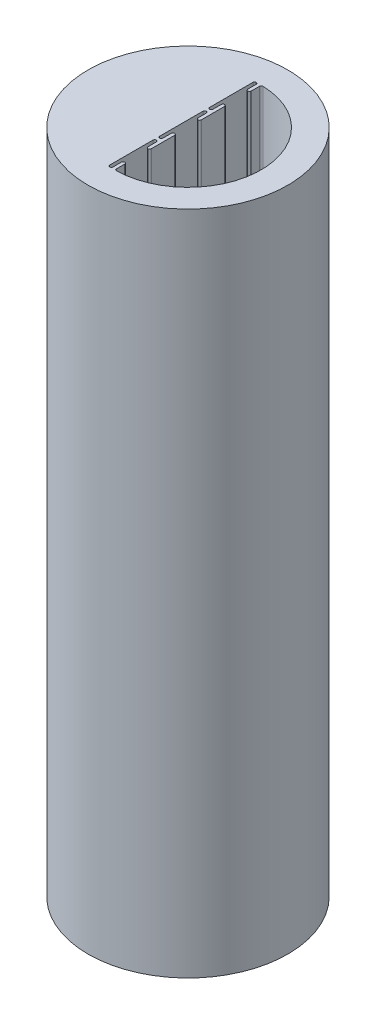
from build123d import *

# Parameters (mm, degrees)
SKETCH1_R           = 30
BOSS_EXTRUDE2_DEPTH = 200
FILLET1_R           = 0.5


with BuildPart() as part:
    # Sketch1 → Boss-Extrude2 (new body)
    # profile 1 of 2: a face of its own
    with BuildSketch(Plane(origin=(0, 0, 0), x_dir=(1, 0, 0), z_dir=(0, 1, 0))):
        with Locations(Location((-24.418699654, 3.823974383, 0), (0, 0, 270))):
            Circle(SKETCH1_R)
        with BuildLine():
            Line((-26.418699654, -18.176025617), (-26.418699654, -4.176025617))
            Line((-26.418699654, -4.176025617), (-26.418699654, -3.176025617))
            Line((-26.418699654, -3.176025617), (-26.418699654, 10.823974383))
            Line((-26.418699654, 10.823974383), (-25.418699654, 10.823974383))
            Line((-25.418699654, 10.823974383), (-25.418699654, 7.323974383))
            Line((-25.418699654, 7.323974383), (-24.418699654, 7.323974383))
            Line((-24.418699654, 7.323974383), (-24.418699654, 10.823974383))
            Line((-24.418699654, 10.823974383), (-24.418699654, 11.823974383))
            Line((-24.418699654, 11.823974383), (-24.418699654, 15.323974383))
            Line((-24.418699654, 15.323974383), (-25.418699654, 15.323974383))
            Line((-25.418699654, 15.323974383), (-25.418699654, 11.823974383))
            Line((-25.418699654, 11.823974383), (-26.418699654, 11.823974383))
            Line((-26.418699654, 11.823974383), (-26.418699654, 25.823974383))
            Line((-26.418699654, 25.823974383), (-25.418699654, 25.823974383))
            Line((-25.418699654, 25.823974383), (-25.418699654, 22.323974383))
            Line((-25.418699654, 22.323974383), (-24.418699654, 22.323974383))
            Line((-24.418699654, 22.323974383), (-24.418699654, 25.823974383))
            ThreePointArc((-24.418699654, 25.823974383), (-2.418699654, 3.823974383), (-24.418699654, -18.176025617))
            Line((-24.418699654, -18.176025617), (-24.418699654, -14.676025617))
            Line((-24.418699654, -14.676025617), (-25.418699654, -14.676025617))
            Line((-25.418699654, -14.676025617), (-25.418699654, -18.176025617))
            Line((-25.418699654, -18.176025617), (-26.418699654, -18.176025617))
        make_face(mode=Mode.SUBTRACT)
    # profile 2 of 2: a face of its own
    with BuildSketch(Plane(origin=(0, 0, 0), x_dir=(1, 0, 0), z_dir=(0, 1, 0))):
        Polygon((-26.418699654, -3.176025617), (-26.418699654, -4.176025617), (-25.418699654, -4.176025617), (-25.418699654, -7.676025617), (-24.418699654, -7.676025617), (-24.418699654, -4.176025617), (-24.418699654, -3.176025617), (-24.418699654, 0.323974383), (-25.418699654, 0.323974383), (-25.418699654, -3.176025617), align=None)
    extrude(amount=BOSS_EXTRUDE2_DEPTH)

    # Fillet1
    fillet1_edges = [part.edges().sort_by_distance(p)[0] for p in [
        (-24.418699654, 100, -25.823974383),
        (-25.418699654, 100, 3.176025617),
        (-25.418699654, 100, -0.323974383),
        (-25.418699654, 100, -15.323974383),
        (-25.418699654, 100, -11.823974383),
        (-25.418699654, 100, -25.823974383),
        (-25.418699654, 100, -22.323974383),
        (-25.418699654, 100, -7.323974383),
        (-25.418699654, 100, -10.823974383),
        (-25.418699654, 100, 4.176025617),
        (-24.418699654, 100, -0.323974383),
        (-24.418699654, 100, -15.323974383),
        (-26.418699654, 100, -11.823974383),
        (-26.418699654, 100, 3.176025617),
        (-26.418699654, 100, -25.823974383),
        (-24.418699654, 100, -22.323974383),
        (-24.418699654, 100, -7.323974383),
        (-26.418699654, 100, -10.823974383),
        (-26.418699654, 100, 4.176025617),
        (-24.418699654, 100, 7.676025617),
        (-25.418699654, 100, 7.676025617),
        (-25.418699654, 100, 14.676025617),
        (-24.418699654, 100, 14.676025617),
        (-24.418699654, 100, 18.176025617),
        (-26.418699654, 100, 18.176025617),
        (-25.418699654, 100, 18.176025617),
    ]]
    fillet(fillet1_edges, radius=FILLET1_R - 0.0001)  # a hair under: the kernel refuses the full size


solid = part.part
